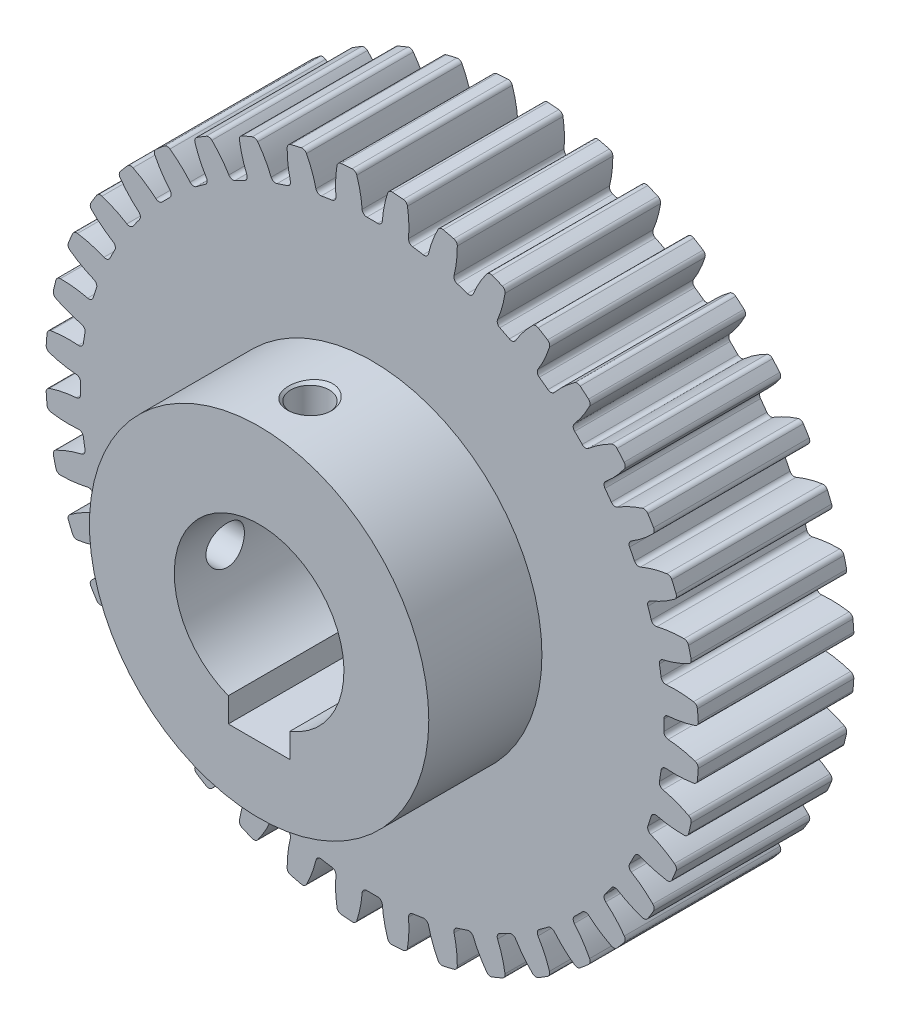
from build123d import *

# Parameters (mm, degrees)
IZIM1_R                        = 57.75
Y_KSEKLIK_EKSTR_ZYON1_DEPTH    = 13.75
KES_EKSTR_ZYON2_DEPTH          = 27.5
RADYUS1_R                      = 0.825
DAIRESEL_KAPLAMA1_COUNT        = 40
RADYUS1_OF_DAIRESEL_KAPLAMA1_R = 0.825
IZIM3_R                        = 30
Y_KSEKLIK_EKSTR_ZYON2_DEPTH    = 20
IZIM4_R                        = 15
KES_EKSTR_ZYON3_DEPTH          = 95.346767112
DAIRESEL_KAPLAMA2_COUNT        = 2
DAIRESEL_KAPLAMA2_ANGLE        = 90
IZIM9_W                        = 10.887137936
IZIM9_H                        = 47.5
KES_EKSTR_ZYON4_DEPTH          = 18.3


with BuildPart() as part:
    # Çizim1 → Yükseklik-Ekstrüzyon1 (new, symmetric)
    with BuildSketch(Plane.XY):
        Circle(IZIM1_R)
    extrude(amount=Y_KSEKLIK_EKSTR_ZYON1_DEPTH, both=True)

    # Çizim2 → Kes-Ekstrüzyon2 (cut)
    with BuildSketch(Plane.XY.offset(13.75)):
        with BuildLine():
            ThreePointArc((-1.742642839, 51.533043789), (0, 51.5625), (1.742642839, 51.533043789))
            ThreePointArc((1.742642839, 51.533043789), (2.097139362, 54.651706066), (2.940222137, 57.67510376))
            ThreePointArc((2.940222137, 57.67510376), (0, 57.75), (-2.940222137, 57.67510376))
            ThreePointArc((-2.940222137, 57.67510376), (-2.097139362, 54.651706066), (-1.742642839, 51.533043789))
        make_face()
    kes_ekstr_zyon2 = extrude(amount=-KES_EKSTR_ZYON2_DEPTH, mode=Mode.SUBTRACT)

    # Radyus1
    radyus1_edges = [part.edges().sort_by_distance(p)[0] for p in [
        (2.940222137, 57.67510376, 0),
        (1.742642839, 51.533043789, 0),
        (-2.940222137, 57.67510376, 0),
        (-1.742642839, 51.533043789, 0),
    ]]
    fillet(radyus1_edges, radius=RADYUS1_R)

    # Dairesel Kaplama1: Kes-Ekstrüzyon2 ×40 about axis
    dairesel_kaplama1_axis = Axis((0, 0, 13.75), (0, 0, 1))
    for i in range(1, DAIRESEL_KAPLAMA1_COUNT):
        add(kes_ekstr_zyon2.rotate(dairesel_kaplama1_axis, i * 360 / DAIRESEL_KAPLAMA1_COUNT), mode=Mode.SUBTRACT)

    # Radyus1 of Dairesel Kaplama1
    radyus1_of_dairesel_kaplama1_edges = [part.edges().sort_by_distance(p)[0] for p in [
        (-6.118350879, 57.424979604, 0),
        (-6.340356123, 51.171195906, 0),
        (-11.926397127, 56.50507545, 0),
        (-9.782732151, 50.625977106, 0),
        (-15.026269791, 55.760861867, 0),
        (-14.267234475, 49.549343353, 0),
        (-20.618904637, 53.943704652, 0),
        (-17.581938131, 48.472330848, 0),
        (-23.564192072, 52.723726651, 0),
        (-21.842806164, 46.707421521, 0),
        (-28.803706286, 50.054060816, 0),
        (-24.948218442, 45.125134934, 0),
        (-31.521885739, 48.388358305, 0),
        (-28.880535473, 42.715407958, 0),
        (-36.279265091, 44.931919884, 0),
        (-31.700190817, 40.666808436, 0),
        (-38.703405963, 42.861507986, 0),
        (-35.20713015, 37.671599287, 0),
        (-42.861507986, 38.703405963, 0),
        (-37.671599287, 35.20713015, 0),
        (-44.931919884, 36.279265091, 0),
        (-40.666808436, 31.700190817, 0),
        (-48.388358305, 31.521885739, 0),
        (-42.715407958, 28.880535473, 0),
        (-50.054060816, 28.803706286, 0),
        (-45.125134934, 24.948218442, 0),
        (-52.723726651, 23.564192072, 0),
        (-46.707421521, 21.842806164, 0),
        (-53.943704652, 20.618904637, 0),
        (-48.472330848, 17.581938131, 0),
        (-55.760861867, 15.026269791, 0),
        (-49.549343353, 14.267234475, 0),
        (-56.50507545, 11.926397127, 0),
        (-50.625977106, 9.782732151, 0),
        (-57.424979604, 6.118350879, 0),
        (-51.171195906, 6.340356123, 0),
        (-57.67510376, 2.940222137, 0),
        (-51.533043789, 1.742642839, 0),
        (-57.67510376, -2.940222137, 0),
        (-51.533043789, -1.742642839, 0),
        (-57.424979604, -6.118350879, 0),
        (-51.171195906, -6.340356123, 0),
        (-56.50507545, -11.926397127, 0),
        (-50.625977106, -9.782732151, 0),
        (-55.760861867, -15.026269791, 0),
        (-49.549343353, -14.267234475, 0),
        (-53.943704652, -20.618904637, 0),
        (-48.472330848, -17.581938131, 0),
        (-52.723726651, -23.564192072, 0),
        (-46.707421521, -21.842806164, 0),
        (-50.054060816, -28.803706286, 0),
        (-45.125134934, -24.948218442, 0),
        (-48.388358305, -31.521885739, 0),
        (-42.715407958, -28.880535473, 0),
        (-44.931919884, -36.279265091, 0),
        (-40.666808436, -31.700190817, 0),
        (-42.861507986, -38.703405963, 0),
        (-37.671599287, -35.20713015, 0),
        (-38.703405963, -42.861507986, 0),
        (-35.20713015, -37.671599287, 0),
        (-36.279265091, -44.931919884, 0),
        (-31.700190817, -40.666808436, 0),
        (-31.521885739, -48.388358305, 0),
        (-28.880535473, -42.715407958, 0),
        (-28.803706286, -50.054060816, 0),
        (-24.948218442, -45.125134934, 0),
        (-23.564192072, -52.723726651, 0),
        (-21.842806164, -46.707421521, 0),
        (-20.618904637, -53.943704652, 0),
        (-17.581938131, -48.472330848, 0),
        (-15.026269791, -55.760861867, 0),
        (-14.267234475, -49.549343353, 0),
        (-11.926397127, -56.50507545, 0),
        (-9.782732151, -50.625977106, 0),
        (-6.118350879, -57.424979604, 0),
        (-6.340356123, -51.171195906, 0),
        (-2.940222137, -57.67510376, 0),
        (-1.742642839, -51.533043789, 0),
        (2.940222137, -57.67510376, 0),
        (1.742642839, -51.533043789, 0),
        (6.118350879, -57.424979604, 0),
        (6.340356123, -51.171195906, 0),
        (11.926397127, -56.50507545, 0),
        (9.782732151, -50.625977106, 0),
        (15.026269791, -55.760861867, 0),
        (14.267234475, -49.549343353, 0),
        (20.618904637, -53.943704652, 0),
        (17.581938131, -48.472330848, 0),
        (23.564192072, -52.723726651, 0),
        (21.842806164, -46.707421521, 0),
        (28.803706286, -50.054060816, 0),
        (24.948218442, -45.125134934, 0),
        (31.521885739, -48.388358305, 0),
        (28.880535473, -42.715407958, 0),
        (36.279265091, -44.931919884, 0),
        (31.700190817, -40.666808436, 0),
        (38.703405963, -42.861507986, 0),
        (35.20713015, -37.671599287, 0),
        (42.861507986, -38.703405963, 0),
        (37.671599287, -35.20713015, 0),
        (44.931919884, -36.279265091, 0),
        (40.666808436, -31.700190817, 0),
        (48.388358305, -31.521885739, 0),
        (42.715407958, -28.880535473, 0),
        (50.054060816, -28.803706286, 0),
        (45.125134934, -24.948218442, 0),
        (52.723726651, -23.564192072, 0),
        (46.707421521, -21.842806164, 0),
        (53.943704652, -20.618904637, 0),
        (48.472330848, -17.581938131, 0),
        (55.760861867, -15.026269791, 0),
        (49.549343353, -14.267234475, 0),
        (56.50507545, -11.926397127, 0),
        (50.625977106, -9.782732151, 0),
        (57.424979604, -6.118350879, 0),
        (51.171195906, -6.340356123, 0),
        (57.67510376, -2.940222137, 0),
        (51.533043789, -1.742642839, 0),
        (57.67510376, 2.940222137, 0),
        (51.533043789, 1.742642839, 0),
        (57.424979604, 6.118350879, 0),
        (51.171195906, 6.340356123, 0),
        (56.50507545, 11.926397127, 0),
        (50.625977106, 9.782732151, 0),
        (55.760861867, 15.026269791, 0),
        (49.549343353, 14.267234475, 0),
        (53.943704652, 20.618904637, 0),
        (48.472330848, 17.581938131, 0),
        (52.723726651, 23.564192072, 0),
        (46.707421521, 21.842806164, 0),
        (50.054060816, 28.803706286, 0),
        (45.125134934, 24.948218442, 0),
        (48.388358305, 31.521885739, 0),
        (42.715407958, 28.880535473, 0),
        (44.931919884, 36.279265091, 0),
        (40.666808436, 31.700190817, 0),
        (42.861507986, 38.703405963, 0),
        (37.671599287, 35.20713015, 0),
        (38.703405963, 42.861507986, 0),
        (35.20713015, 37.671599287, 0),
        (36.279265091, 44.931919884, 0),
        (31.700190817, 40.666808436, 0),
        (31.521885739, 48.388358305, 0),
        (28.880535473, 42.715407958, 0),
        (28.803706286, 50.054060816, 0),
        (24.948218442, 45.125134934, 0),
        (23.564192072, 52.723726651, 0),
        (21.842806164, 46.707421521, 0),
        (20.618904637, 53.943704652, 0),
        (17.581938131, 48.472330848, 0),
        (15.026269791, 55.760861867, 0),
        (14.267234475, 49.549343353, 0),
        (11.926397127, 56.50507545, 0),
        (9.782732151, 50.625977106, 0),
        (6.118350879, 57.424979604, 0),
        (6.340356123, 51.171195906, 0),
    ]]
    fillet(radyus1_of_dairesel_kaplama1_edges, radius=RADYUS1_OF_DAIRESEL_KAPLAMA1_R)

    # Çizim3 → Yükseklik-Ekstrüzyon2 (add)
    with BuildSketch(Plane.XY.offset(13.75)):
        Circle(IZIM3_R)
    extrude(amount=Y_KSEKLIK_EKSTR_ZYON2_DEPTH)

    # Çizim4 → Kes-Ekstrüzyon3 (cut, through all)
    with BuildSketch(Plane.XY.offset(33.75)):
        Circle(IZIM4_R)
    extrude(amount=-KES_EKSTR_ZYON3_DEPTH, mode=Mode.SUBTRACT)

    # Çizim8 → M8 Dişli Delik1 (revolve, cut)
    with BuildSketch(Plane(origin=(0, 30, 24.75), x_dir=(0, 0, 1), z_dir=(1, 0, 0))):
        Polygon((0, 0), (0, 24.292926105), (3.4, 22.25), (3.4, 0.625), (4.025, 0), align=None)
    m8_di_li_delik1 = revolve(axis=Axis((0, 36.35, 24.75), (0, -1, 0)), mode=Mode.SUBTRACT)

    # Dairesel Kaplama2: M8 Dişli Delik1 ×2 about axis
    dairesel_kaplama2_axis = Axis((0, 0, 33.75), (0, 0, 1))
    for i in range(1, DAIRESEL_KAPLAMA2_COUNT):
        add(m8_di_li_delik1.rotate(dairesel_kaplama2_axis, i * DAIRESEL_KAPLAMA2_ANGLE / (DAIRESEL_KAPLAMA2_COUNT - 1)), mode=Mode.SUBTRACT)

    # Çizim9 → Kes-Ekstrüzyon4 (cut)
    with BuildSketch(Plane(origin=(0, 0, 0), x_dir=(1, 0, 0), z_dir=(0, 1, 0))):
        with Locations((0, -10)):
            Rectangle(IZIM9_W, IZIM9_H)
    extrude(amount=-KES_EKSTR_ZYON4_DEPTH, mode=Mode.SUBTRACT)


solid = part.part
